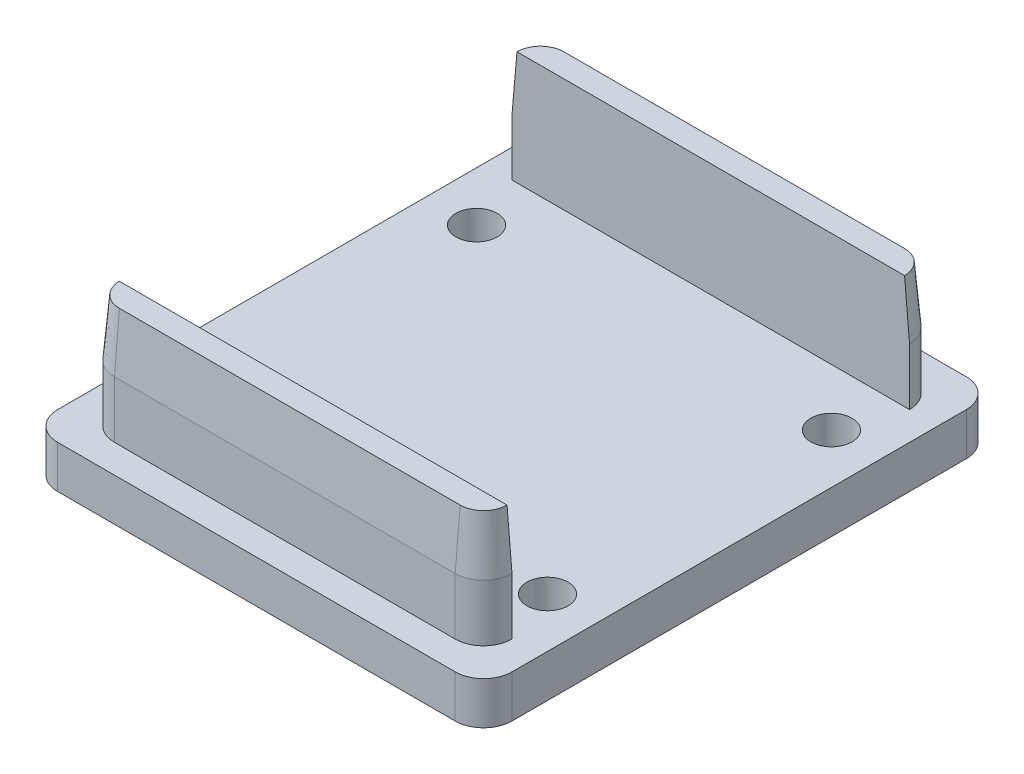
from build123d import *
from OCP.BRepFilletAPI import BRepFilletAPI_MakeChamfer

# Parameters (mm, degrees)
SKETCH1_W                                  = 32
SKETCH1_H                                  = 36
BOSS_EXTRUDE1_DEPTH                        = 3
SKETCH4_W                                  = 28
SKETCH4_H                                  = 2
BOSS_EXTRUDE3_DEPTH                        = 8
FILLET4_R                                  = 2
CHAMFER2_SIZE                              = 4
CHAMFER2_SIZE2                             = 0.349954654
SKETCH5_R                                  = 1.45
CUT_EXTRUDE1_DEPTH                         = 2.3
MIRROR1_AT_THE_SECOND_PLANE_COPY_1_SKETC_R = 1.45
MIRROR1_AT_THE_SECOND_PLANE_COPY_1_DEPTH   = 2.3


with BuildPart() as part:
    # Sketch1 → Boss-Extrude1 (new body)
    with BuildSketch(Plane(origin=(0, 0, 0), x_dir=(1, 0, 0), z_dir=(0, 1, 0))):
        Rectangle(SKETCH1_W, SKETCH1_H)
    extrude(amount=BOSS_EXTRUDE1_DEPTH)

    # Sketch4 → Boss-Extrude3 (add)
    with BuildSketch(Plane(origin=(0, 3, 0), x_dir=(1, 0, 0), z_dir=(0, 1, 0))):
        with Locations((0, 15)):
            Rectangle(SKETCH4_W, SKETCH4_H)
        with Locations((0, -15)):
            Rectangle(SKETCH4_W, SKETCH4_H)
    extrude(amount=BOSS_EXTRUDE3_DEPTH)

    # Fillet4
    fillet4_edges = [part.edges().sort_by_distance(p)[0] for p in [
        (14, 7, -16),
        (14, 7, 16),
        (-16, 1.5, 18),
        (16, 1.5, 18),
        (-16, 1.5, -18),
        (16, 1.5, -18),
        (-14, 7, 16),
        (-14, 7, -16),
    ]]
    fillet(fillet4_edges, radius=FILLET4_R - 0.0001)  # a hair under: the kernel refuses the full size

    # Chamfer2: one chamfer whose edges measure the first distance from different faces: ONE call of the kernel's chamfer builder (chamfer() names one face for all edges)
    chamfer2_edges_1 = [part.edges().sort_by_distance(p)[0] for p in [
        (0, 11, 16),
    ]]
    chamfer2_side_1 = [part.faces().sort_by_distance(p)[0] for p in [
        (0, 7, 16),
    ]]
    chamfer2_edges_2 = [part.edges().sort_by_distance(p)[0] for p in [
        (13.414242852, 11, 15.414242852),
    ]]
    chamfer2_side_2 = [part.faces().sort_by_distance(p)[0] for p in [
        (13.414242852, 7, 15.414242852),
    ]]
    chamfer2_edges_3 = [part.edges().sort_by_distance(p)[0] for p in [
        (-13.414242852, 11, 15.414242852),
    ]]
    chamfer2_side_3 = [part.faces().sort_by_distance(p)[0] for p in [
        (-13.414242852, 7, 15.414242852),
    ]]
    chamfer2_edges_4 = [part.edges().sort_by_distance(p)[0] for p in [
        (0, 11, -16),
    ]]
    chamfer2_side_4 = [part.faces().sort_by_distance(p)[0] for p in [
        (0, 7, -16),
    ]]
    chamfer2_edges_5 = [part.edges().sort_by_distance(p)[0] for p in [
        (13.414242852, 11, -15.414242852),
    ]]
    chamfer2_side_5 = [part.faces().sort_by_distance(p)[0] for p in [
        (13.414242852, 7, -15.414242852),
    ]]
    chamfer2_edges_6 = [part.edges().sort_by_distance(p)[0] for p in [
        (-13.414242852, 11, -15.414242852),
    ]]
    chamfer2_side_6 = [part.faces().sort_by_distance(p)[0] for p in [
        (-13.414242852, 7, -15.414242852),
    ]]
    chamfer2 = BRepFilletAPI_MakeChamfer(part.part.solid().wrapped)
    for e in chamfer2_edges_1:
        chamfer2.Add(CHAMFER2_SIZE, CHAMFER2_SIZE2, e.wrapped, chamfer2_side_1[0].wrapped)  # the first distance lies on this face
    for e in chamfer2_edges_2:
        chamfer2.Add(CHAMFER2_SIZE, CHAMFER2_SIZE2, e.wrapped, chamfer2_side_2[0].wrapped)  # the first distance lies on this face
    for e in chamfer2_edges_3:
        chamfer2.Add(CHAMFER2_SIZE, CHAMFER2_SIZE2, e.wrapped, chamfer2_side_3[0].wrapped)  # the first distance lies on this face
    for e in chamfer2_edges_4:
        chamfer2.Add(CHAMFER2_SIZE, CHAMFER2_SIZE2, e.wrapped, chamfer2_side_4[0].wrapped)  # the first distance lies on this face
    for e in chamfer2_edges_5:
        chamfer2.Add(CHAMFER2_SIZE, CHAMFER2_SIZE2, e.wrapped, chamfer2_side_5[0].wrapped)  # the first distance lies on this face
    for e in chamfer2_edges_6:
        chamfer2.Add(CHAMFER2_SIZE, CHAMFER2_SIZE2, e.wrapped, chamfer2_side_6[0].wrapped)  # the first distance lies on this face
    add(Compound.cast(chamfer2.Shape()), mode=Mode.REPLACE)

    # Sketch5 → Cut-Extrude1 (cut)
    with BuildSketch(Plane(origin=(0, 3, 0), x_dir=(1, 0, 0), z_dir=(0, 1, 0))):
        with Locations(Location((-12.5, 10, 0), (0, 0, 270))):
            Circle(SKETCH5_R)
    cut_extrude1 = extrude(amount=-CUT_EXTRUDE1_DEPTH, mode=Mode.SUBTRACT)

    # Mirror1: Cut-Extrude1 across plane
    add(cut_extrude1.mirror(Plane(origin=(0, 0, 0), x_dir=(0, 0, 1), z_dir=(1, 0, 0))), mode=Mode.SUBTRACT)

    # Mirror1 at the second plane: Cut-Extrude1 across plane
    add(cut_extrude1.mirror(Plane.XY), mode=Mode.SUBTRACT)

    # Mirror1 at the second plane copy 1 sketc → Mirror1 at the second plane copy 1 (cut)
    with BuildSketch(Plane(origin=(0, 3, 0), x_dir=(-1, 0, 0), z_dir=(0, 1, 0))):
        with Locations(Location((-12.5, 10, 0), (0, 0, 270))):
            Circle(MIRROR1_AT_THE_SECOND_PLANE_COPY_1_SKETC_R)
    extrude(amount=-MIRROR1_AT_THE_SECOND_PLANE_COPY_1_DEPTH, mode=Mode.SUBTRACT)


solid = part.part
